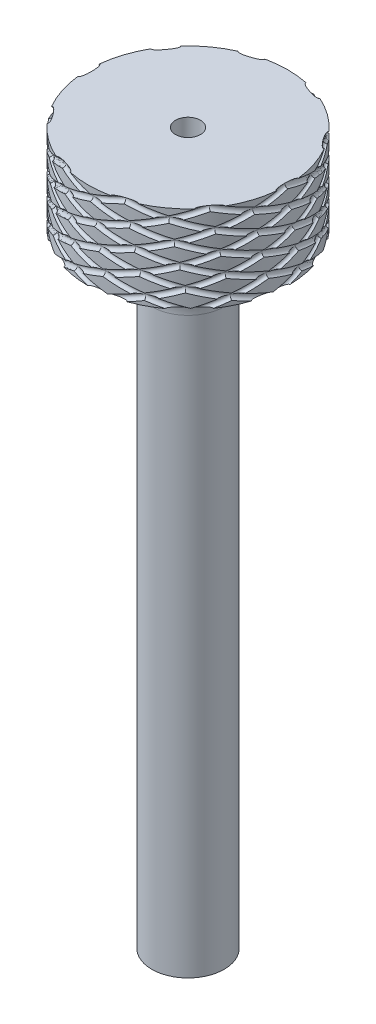
from build123d import *

# Parameters (mm, degrees)
SKETCH1_R           = 2.9
BOSS_EXTRUDE1_DEPTH = 50
SKETCH2_R           = 8
BOSS_EXTRUDE2_DEPTH = 7
SKETCH7_R           = 1
CUT_EXTRUDE1_DEPTH  = 57
FILLET1_R           = 4
CUT_SWEEP2_PITCH    = 15
CIRPATTERN2_COUNT   = 10
CUT_SWEEP4_PITCH    = 17
CIRPATTERN3_COUNT   = 10


with BuildPart() as part:
    # Sketch1 → Boss-Extrude1 (new body)
    with BuildSketch(Plane(origin=(0, 0, 0), x_dir=(1, 0, 0), z_dir=(0, 1, 0))):
        with Locations(Location((0, 0, 0), (0, 0, 270))):
            Circle(SKETCH1_R)
    extrude(amount=BOSS_EXTRUDE1_DEPTH)

    # Sketch2 → Boss-Extrude2 (add)
    with BuildSketch(Plane(origin=(0, 50, 0), x_dir=(1, 0, 0), z_dir=(0, 1, 0))):
        with Locations(Location((0, 0, 0), (0, 0, 270))):
            Circle(SKETCH2_R)
    extrude(amount=BOSS_EXTRUDE2_DEPTH)

    # Sketch7 → Cut-Extrude1 (cut)
    with BuildSketch(Plane.XZ):
        with Locations(Location((0, 0, 0), (0, 0, 270))):
            Circle(SKETCH7_R)
    extrude(amount=-CUT_EXTRUDE1_DEPTH, mode=Mode.SUBTRACT)

    # Fillet1
    fillet1_edges = [part.edges().sort_by_distance(p)[0] for p in [
        (0, 50, -2.9),
    ]]
    fillet(fillet1_edges, radius=FILLET1_R)

    # Cut-Sweep2: arcs per turn and ends read off the stored shape
    # Cut-Sweep2: the profile of Cut-Sweep2 profile screwed along a left-hand helix through 2 turns, 18 arcs to a turn; built about Z, then put on its axis
    cut_sweep2_z = Axis((0, 0, 0), (0, 0, 1))
    cut_sweep2_corners = [(8, -0.071488657, -15.23956079), (8.25, 0, -15), (8, 0.071488657, -14.76043921), (7.75, 0, -15)]
    with BuildLine(mode=Mode.PRIVATE) as cut_sweep2_profile:
        ThreePointArc((8, -0.071488657, -15.23956079), (8.176776695, -0.050550114, -15.169395059), (8.25, 0, -15))
        ThreePointArc((8.25, 0, -15), (8.176776695, 0.050550114, -14.830604941), (8, 0.071488657, -14.76043921))
        ThreePointArc((8, 0.071488657, -14.76043921), (7.823223305, 0.050550114, -14.830604941), (7.75, 0, -15))
        ThreePointArc((7.75, 0, -15), (7.823223305, -0.050550114, -15.169395059), (8, -0.071488657, -15.23956079))
    cut_sweep2_cap = Face(cut_sweep2_profile.wire())
    cut_sweep2_arcs = [((8, -0.071488657, -15.23956079), (8.25, -0.071488657, -15.23956079), (8.25, 0, -15), (1, 0.7071067811865476, 1)), ((8.25, 0, -15), (8.25, 0.071488657, -14.76043921), (8, 0.071488657, -14.76043921), (1, 0.7071067811865476, 1)), ((8, 0.071488657, -14.76043921), (7.75, 0.071488657, -14.76043921), (7.75, 0, -15), (1, 0.7071067811865476, 1)), ((7.75, 0, -15), (7.75, -0.071488657, -15.23956079), (8, -0.071488657, -15.23956079), (1, 0.7071067811865476, 1))]  # start, shoulder, end, weights
    cut_sweep2_turn_angles = [0, -10, -20, -30, -40, -50, -60, -70, -80, -90, -100, -110, -120, -130, -140, -150, -160, -170, -180, -190, -200, -210, -220, -230, -240, -250, -260, -270, -280, -290, -300, -310, -320, -330, -340, -350, -360]
    cut_sweep2_turn_weights = [1, 0.984807753012208, 1, 0.984807753012208, 1, 0.984807753012208, 1, 0.984807753012208, 1, 0.984807753012208, 1, 0.984807753012208, 1, 0.984807753012208, 1, 0.984807753012208, 1, 0.984807753012208, 1, 0.984807753012208, 1, 0.984807753012208, 1, 0.984807753012208, 1, 0.984807753012208, 1, 0.984807753012208, 1, 0.984807753012208, 1, 0.984807753012208, 1, 0.984807753012208, 1, 0.984807753012208, 1]
    cut_sweep2_turn_sides = [Face.make_bezier_surface([[Vector(p[j][0], p[j][1], 0).rotate(cut_sweep2_z, cut_sweep2_turn_angles[2 * i + k]) / cut_sweep2_turn_weights[2 * i + k] + Vector(0, 0, p[j][2] + -CUT_SWEEP2_PITCH * cut_sweep2_turn_angles[2 * i + k] / 360) for k in range(3)] for j in range(3)], [[p[3][j] * cut_sweep2_turn_weights[2 * i + k] for k in range(3)] for j in range(3)]) for p in cut_sweep2_arcs for i in range(18)]
    cut_sweep2 = Plane(origin=(0, 57, 0), x_dir=(-1, 0, 0), z_dir=(0, -1, 0)) * Solid(Shell([*[p.moved(Location((0, 0, CUT_SWEEP2_PITCH * i))) for i in range(2) for p in cut_sweep2_turn_sides], cut_sweep2_cap, cut_sweep2_cap.rotate(cut_sweep2_z, -720).moved(Location((0, 0, -CUT_SWEEP2_PITCH * -720 / 360)))]))
    add(cut_sweep2, mode=Mode.SUBTRACT)

    # CirPattern2: Cut-Sweep2 ×10 about axis
    cirpattern2_axis = Axis((0, 59.828427125, 0), (0, -1, 0))
    for i in range(1, CIRPATTERN2_COUNT):
        add(cut_sweep2.rotate(cirpattern2_axis, i * 360 / CIRPATTERN2_COUNT), mode=Mode.SUBTRACT)

    # Cut-Sweep4: arcs per turn and ends read off the stored shape
    # Cut-Sweep4: the profile of Cut-Sweep4 profile screwed along a right-hand helix through 1 turns, 18 arcs to a turn; built about Z, then put on its axis
    cut_sweep4_z = Axis((0, 0, 0), (0, 0, 1))
    cut_sweep4_corners = [(8, -0.080094373, 0.236822489), (8.25, 0, 0), (8, 0.080094373, -0.236822489), (7.75, 0, 0)]
    with BuildLine(mode=Mode.PRIVATE) as cut_sweep4_profile:
        ThreePointArc((8, -0.080094373, 0.236822489), (8.176776695, -0.056635274, 0.167458788), (8.25, 0, 0))
        ThreePointArc((8.25, 0, 0), (8.176776695, 0.056635274, -0.167458788), (8, 0.080094373, -0.236822489))
        ThreePointArc((8, 0.080094373, -0.236822489), (7.823223305, 0.056635274, -0.167458788), (7.75, 0, 0))
        ThreePointArc((7.75, 0, 0), (7.823223305, -0.056635274, 0.167458788), (8, -0.080094373, 0.236822489))
    cut_sweep4_cap = Face(cut_sweep4_profile.wire())
    cut_sweep4_arcs = [((8, -0.080094373, 0.236822489), (8.25, -0.080094373, 0.236822489), (8.25, 0, 0), (1, 0.7071067811865476, 1)), ((8.25, 0, 0), (8.25, 0.080094373, -0.236822489), (8, 0.080094373, -0.236822489), (1, 0.7071067811865476, 1)), ((8, 0.080094373, -0.236822489), (7.75, 0.080094373, -0.236822489), (7.75, 0, 0), (1, 0.7071067811865476, 1)), ((7.75, 0, 0), (7.75, -0.080094373, 0.236822489), (8, -0.080094373, 0.236822489), (1, 0.7071067811865476, 1))]  # start, shoulder, end, weights
    cut_sweep4_turn_angles = [0, 10, 20, 30, 40, 50, 60, 70, 80, 90, 100, 110, 120, 130, 140, 150, 160, 170, 180, 190, 200, 210, 220, 230, 240, 250, 260, 270, 280, 290, 300, 310, 320, 330, 340, 350, 360]
    cut_sweep4_turn_weights = [1, 0.984807753012208, 1, 0.984807753012208, 1, 0.984807753012208, 1, 0.984807753012208, 1, 0.984807753012208, 1, 0.984807753012208, 1, 0.984807753012208, 1, 0.984807753012208, 1, 0.984807753012208, 1, 0.984807753012208, 1, 0.984807753012208, 1, 0.984807753012208, 1, 0.984807753012208, 1, 0.984807753012208, 1, 0.984807753012208, 1, 0.984807753012208, 1, 0.984807753012208, 1, 0.984807753012208, 1]
    cut_sweep4_turn_sides = [Face.make_bezier_surface([[Vector(p[j][0], p[j][1], 0).rotate(cut_sweep4_z, cut_sweep4_turn_angles[2 * i + k]) / cut_sweep4_turn_weights[2 * i + k] + Vector(0, 0, p[j][2] + CUT_SWEEP4_PITCH * cut_sweep4_turn_angles[2 * i + k] / 360) for k in range(3)] for j in range(3)], [[p[3][j] * cut_sweep4_turn_weights[2 * i + k] for k in range(3)] for j in range(3)]) for p in cut_sweep4_arcs for i in range(18)]
    cut_sweep4 = Plane(origin=(0, 57, 0), x_dir=(-1, 0, 0), z_dir=(0, -1, 0)) * Solid(Shell([*cut_sweep4_turn_sides, cut_sweep4_cap, cut_sweep4_cap.rotate(cut_sweep4_z, 360).moved(Location((0, 0, CUT_SWEEP4_PITCH * 360 / 360)))]))
    add(cut_sweep4, mode=Mode.SUBTRACT)

    # CirPattern3: Cut-Sweep4 ×10 about axis
    cirpattern3_axis = Axis((0, 59.828427125, 0), (0, -1, 0))
    for i in range(1, CIRPATTERN3_COUNT):
        add(cut_sweep4.rotate(cirpattern3_axis, i * 360 / CIRPATTERN3_COUNT), mode=Mode.SUBTRACT)


solid = part.part
